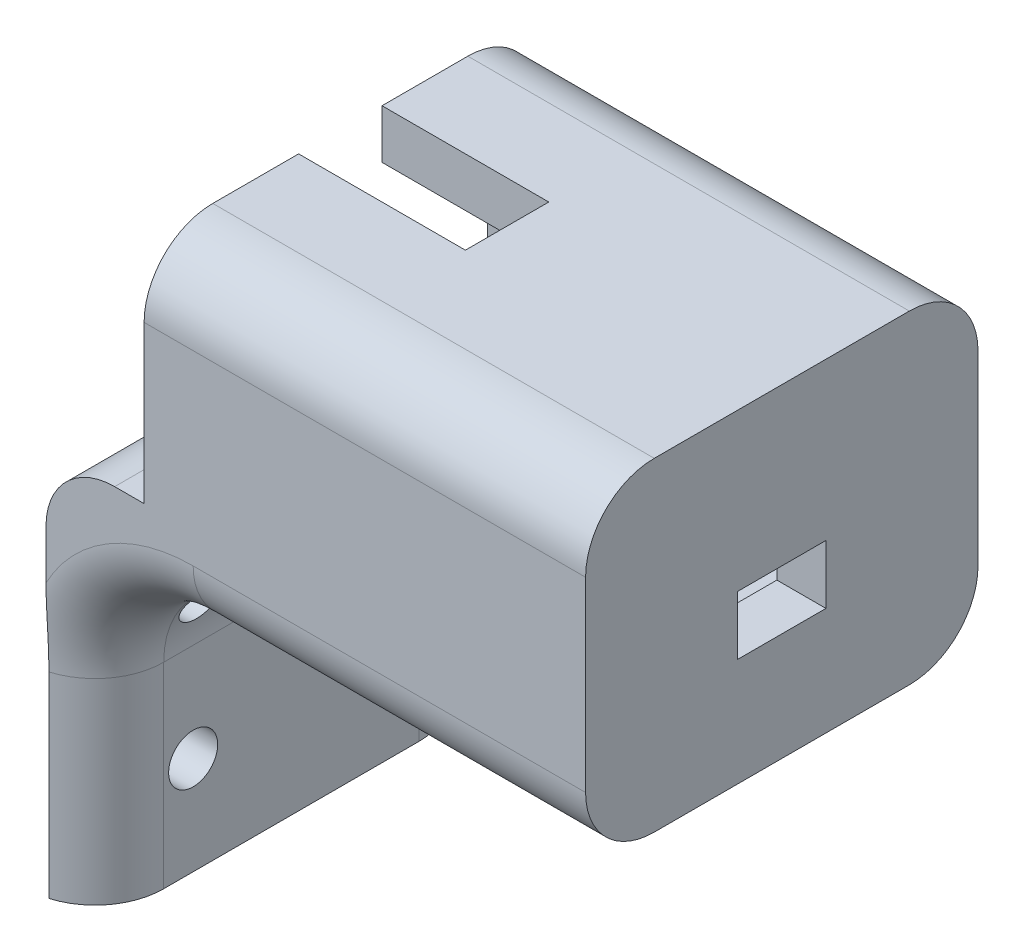
from build123d import *

# Parameters (mm, degrees)
SKETCH1_W           = 45
SKETCH1_H           = 40
BOSS_EXTRUDE1_DEPTH = 28
SKETCH5_W           = 30
SKETCH5_H           = 18
CUT_EXTRUDE2_DEPTH  = 40
SKETCH6_W           = 8.5
SKETCH6_H           = 5
CUT_EXTRUDE3_DEPTH  = 17
SKETCH7_W           = 9
SKETCH7_H           = 6
CUT_EXTRUDE4_DEPTH  = 17
SKETCH8_W           = 45
SKETCH8_H           = 40
BOSS_EXTRUDE2_DEPTH = 5
SKETCH9_W           = 40
SKETCH9_H           = 10
BOSS_EXTRUDE3_DEPTH = 10
SKETCH10_W          = 5
SKETCH10_H          = 40
BOSS_EXTRUDE4_DEPTH = 30
SKETCH13_R          = 2.5
CUT_EXTRUDE5_DEPTH  = 27
FILLET1_R           = 10
FILLET3_R           = 7
FILLET4_R           = 7


with BuildPart() as part:
    # Sketch1 → Boss-Extrude1 (new body)
    with BuildSketch(Plane(origin=(0, 0, 0), x_dir=(1, 0, 0), z_dir=(0, 1, 0))):
        Rectangle(SKETCH1_W, SKETCH1_H)
    extrude(amount=BOSS_EXTRUDE1_DEPTH)

    # Sketch5 → Cut-Extrude2 (cut)
    with BuildSketch(Plane.ZY.offset(22.5)):
        with Locations((0, 14)):
            Rectangle(SKETCH5_W, SKETCH5_H)
    extrude(amount=-CUT_EXTRUDE2_DEPTH, mode=Mode.SUBTRACT)

    # Sketch6 → Cut-Extrude3 (cut)
    with BuildSketch(Plane.ZY.offset(22.5)):
        with Locations((0, 25.5)):
            Rectangle(SKETCH6_W, SKETCH6_H)
    extrude(amount=-CUT_EXTRUDE3_DEPTH, mode=Mode.SUBTRACT)

    # Sketch7 → Cut-Extrude4 (cut)
    with BuildSketch(Plane(origin=(22.5, 0, 0), x_dir=(0, 0, -1), z_dir=(1, 0, 0))):
        with Locations((0, 9)):
            Rectangle(SKETCH7_W, SKETCH7_H)
    extrude(amount=-CUT_EXTRUDE4_DEPTH, mode=Mode.SUBTRACT)

    # Sketch8 → Boss-Extrude2 (add)
    with BuildSketch(Plane.XZ):
        Rectangle(SKETCH8_W, SKETCH8_H)
    extrude(amount=BOSS_EXTRUDE2_DEPTH)

    # Sketch9 → Boss-Extrude3 (add)
    with BuildSketch(Plane.ZY.offset(22.5)):
        Rectangle(SKETCH9_W, SKETCH9_H)
    extrude(amount=BOSS_EXTRUDE3_DEPTH)

    # Sketch10 → Boss-Extrude4 (add)
    with BuildSketch(Plane.XZ.offset(5)):
        with Locations((-30, 0)):
            Rectangle(SKETCH10_W, SKETCH10_H)
    extrude(amount=BOSS_EXTRUDE4_DEPTH)

    # Sketch13 → Cut-Extrude5 (cut)
    with BuildSketch(Plane.ZY.offset(32.5)):
        with Locations((-10, -25)):
            Circle(SKETCH13_R)
        with Locations((-10, -10)):
            Circle(SKETCH13_R)
        with Locations((10, -10)):
            Circle(SKETCH13_R)
        with Locations((10, -25)):
            Circle(SKETCH13_R)
    extrude(amount=-CUT_EXTRUDE5_DEPTH, mode=Mode.SUBTRACT)

    # Fillet1
    # the kernel refuses this fillet: 10 mm, written as the material it adds along each edge
    with BuildSketch(Plane(origin=(-27.5, -5, 20), x_dir=(0, -1, 0), z_dir=(0, 0, -1))) as fillet1_piece_1_section:
        with BuildLine():
            CenterArc((FILLET1_R, -FILLET1_R), FILLET1_R, 90, 90)
            Line((0, -FILLET1_R), (0, 0))
            Line((0, 0), (FILLET1_R, 0))
        make_face()
    fillet1_piece_1 = extrude(amount=40, mode=Mode.PRIVATE)
    fillet1_piece_1 = fillet1_piece_1 - Plane(origin=(-25.136048253, -10, 10), x_dir=(0, 0, 1), z_dir=(-1, 0, 0)) * Cylinder(2.5, 121, mode=Mode.PRIVATE)
    fillet1_piece_1 = fillet1_piece_1 - Plane(origin=(-25.136048253, -10, -10), x_dir=(0, 0, 1), z_dir=(-1, 0, 0)) * Cylinder(2.5, 121, mode=Mode.PRIVATE)
    add(fillet1_piece_1)

    # Fillet3
    # the kernel refuses this fillet: 7 mm, written as the material it takes off along each edge
    with BuildSketch(Plane(origin=(-27.5, -15, -20), x_dir=(-1, 0, 0), z_dir=(0, -1, 0))) as fillet3_piece_1:
        with BuildLine():
            CenterArc((FILLET3_R, -FILLET3_R), FILLET3_R, 90, 90)
            Line((0, -FILLET3_R), (0, 0))
            Line((0, 0), (FILLET3_R, 0))
        make_face()
    extrude(amount=37.5, mode=Mode.SUBTRACT)
    with BuildSketch(Plane(origin=(-17.5, -15, -20), x_dir=(-1, 0, 0), z_dir=(0, -1, 0))) as fillet3_piece_2:
        with BuildLine():
            CenterArc((10 + FILLET3_R, -FILLET3_R), FILLET3_R, 90, 90)
            Line((10 + FILLET3_R, 0), (10, 0))
            Line((10, 0), (10, -FILLET3_R))
        make_face()
    revolve(axis=Axis((-17.5, -15, -20), (0, 0, -1)), revolution_arc=90, mode=Mode.SUBTRACT)
    with BuildSketch(Plane(origin=(-27.5, -15, 20), x_dir=(-1, 0, 0), z_dir=(0, -1, 0))) as fillet3_piece_3:
        with BuildLine():
            CenterArc((FILLET3_R, FILLET3_R), FILLET3_R, 180, 90)
            Line((0, FILLET3_R), (0, 0))
            Line((0, 0), (FILLET3_R, 0))
        make_face()
    extrude(amount=37.5, mode=Mode.SUBTRACT)
    with BuildSketch(Plane(origin=(-17.5, -15, 20), x_dir=(-1, 0, 0), z_dir=(0, -1, 0))) as fillet3_piece_4:
        with BuildLine():
            CenterArc((10 + FILLET3_R, FILLET3_R), FILLET3_R, 180, 90)
            Line((10 + FILLET3_R, 0), (10, 0))
            Line((10, 0), (10, FILLET3_R))
        make_face()
    revolve(axis=Axis((-17.5, -15, 20), (0, 0, -1)), revolution_arc=90, mode=Mode.SUBTRACT)
    with BuildSketch(Plane(origin=(40, -5, -20), x_dir=(0, 0, 1), z_dir=(-1, 0, 0))) as fillet3_piece_5:
        with BuildLine():
            CenterArc((FILLET3_R, FILLET3_R), FILLET3_R, 180, 90)
            Line((0, FILLET3_R), (0, 0))
            Line((0, 0), (FILLET3_R, 0))
        make_face()
    extrude(amount=57.5, mode=Mode.SUBTRACT)
    with BuildSketch(Plane(origin=(40, 28, -20), x_dir=(0, 0, 1), z_dir=(-1, 0, 0)), Plane(origin=(-40, 28, 20), x_dir=(0, 0, -1), z_dir=(1, 0, 0))) as fillet3_piece_6:
        with BuildLine():
            CenterArc((FILLET3_R, -FILLET3_R), FILLET3_R, 90, 90)
            Line((0, -FILLET3_R), (0, 0))
            Line((0, 0), (FILLET3_R, 0))
        make_face()
    extrude(amount=80, mode=Mode.SUBTRACT)
    with BuildSketch(Plane(origin=(40, -5, 20), x_dir=(0, 0, -1), z_dir=(-1, 0, 0))) as fillet3_piece_7:
        with BuildLine():
            CenterArc((FILLET3_R, -FILLET3_R), FILLET3_R, 90, 90)
            Line((0, -FILLET3_R), (0, 0))
            Line((0, 0), (FILLET3_R, 0))
        make_face()
    extrude(amount=57.5, mode=Mode.SUBTRACT)

    # Fillet4
    fillet4_edges = [part.edges().sort_by_distance(p)[0] for p in [
        (-32.5, 5, 0),
    ]]
    fillet(fillet4_edges, radius=FILLET4_R)


solid = part.part
